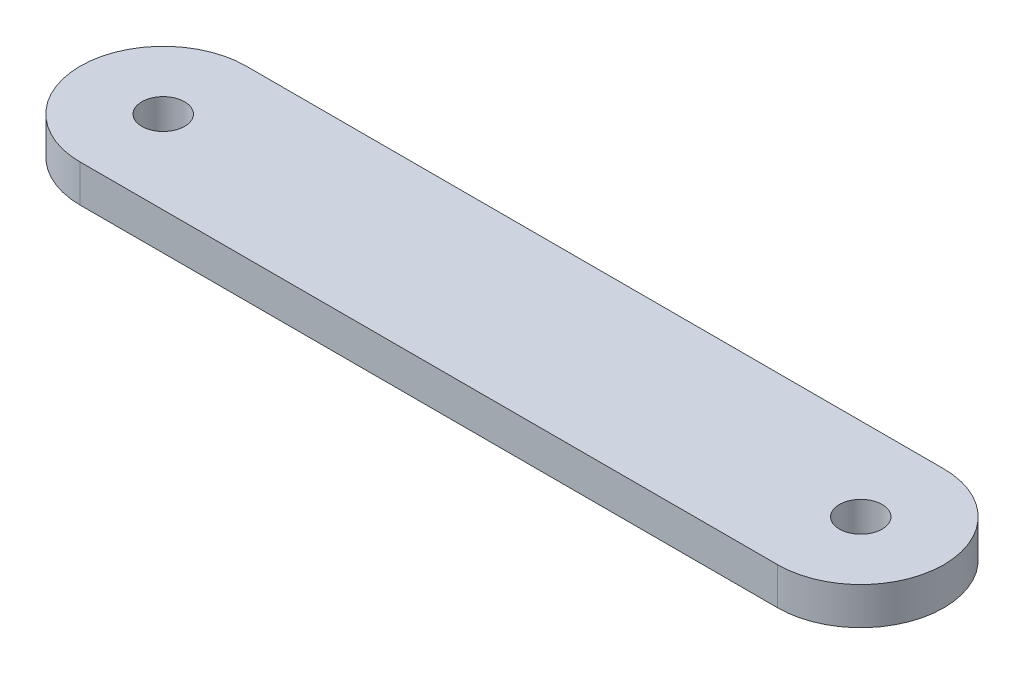
from build123d import *

# Parameters (mm, degrees)
BOSS_EXTRUDE1_DEPTH  = 4.5
SKETCH3_R            = 2.575
F_5_15MM_HOLES_DEPTH = 54.143673189


with BuildPart() as part:
    # Sketch2 → Boss-Extrude1 (new body)
    with BuildSketch(Plane(origin=(0, 0, 0), x_dir=(1, 0, 0), z_dir=(0, 1, 0))):
        with BuildLine():
            Line((42, 10), (-42, 10))
            ThreePointArc((-42, 10), (-52, 0), (-42, -10))
            Line((-42, -10), (42, -10))
            ThreePointArc((42, -10), (52, 0), (42, 10))
        make_face()
    extrude(amount=BOSS_EXTRUDE1_DEPTH)

    # Sketch3 → 5.15mm holes (cut, through all)
    with BuildSketch(Plane(origin=(0, 4.5, 0), x_dir=(1, 0, 0), z_dir=(0, 1, 0))):
        with Locations((42, 0)):
            Circle(SKETCH3_R)
        with Locations((-42, 0)):
            Circle(SKETCH3_R)
    extrude(amount=-F_5_15MM_HOLES_DEPTH, mode=Mode.SUBTRACT)


solid = part.part
